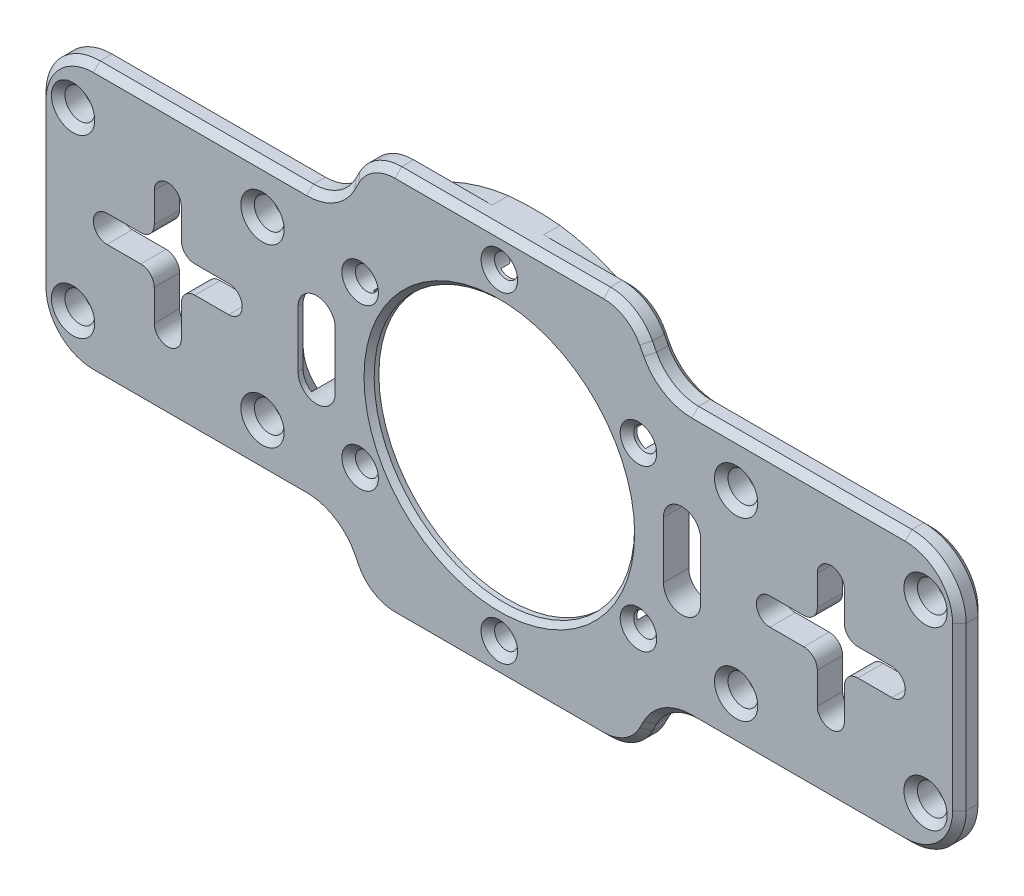
from build123d import *

# Parameters (mm, degrees)
SKETCH1_W           = 136
SKETCH1_H           = 57.5
SKETCH1_R           = 19.25
BOSS_EXTRUDE1_DEPTH = 3.75
SKETCH2_R           = 22.6
CUT_EXTRUDE1_DEPTH  = 2.3
SKETCH8_R           = 27
BOSS_EXTRUDE2_DEPTH = 2
SKETCH3_R           = 1.7
CUT_EXTRUDE2_DEPTH  = 75.051502348
CUT_EXTRUDE7_DEPTH  = 75.051502348
FILLET3_R           = 7
FILLET4_R           = 8
CHAMFER1_SIZE       = 1
SKETCH4_R           = 2.2
CUT_EXTRUDE3_DEPTH  = 75.051502348
CHAMFER2_SIZE       = 1
CHAMFER3_SIZE       = 1
CHAMFER4_SIZE       = 0.75
CUT_EXTRUDE4_DEPTH  = 75.051502348
FILLET1_R           = 2
FILLET2_R           = 2
SKETCH9_W           = 41
SKETCH9_H           = 37.4730356
CUT_EXTRUDE5_DEPTH  = 74.923101976
CUT_EXTRUDE6_DEPTH  = 75.051502395
CHAMFER6_SIZE       = 3
CHAMFER7_SIZE       = 1


with BuildPart() as part:
    # Sketch1 → Boss-Extrude1 (new body)
    with BuildSketch(Plane.XY):
        Rectangle(SKETCH1_W, SKETCH1_H)
        Circle(SKETCH1_R, mode=Mode.SUBTRACT)
    extrude(amount=BOSS_EXTRUDE1_DEPTH)

    # Sketch2 → Cut-Extrude1 (cut)
    with BuildSketch(Plane(origin=(0, 0, 0), x_dir=(-1, 0, 0), z_dir=(0, 0, -1))):
        Circle(SKETCH2_R)
    extrude(amount=-CUT_EXTRUDE1_DEPTH, mode=Mode.SUBTRACT)

    # Sketch8 → Boss-Extrude2 (add)
    with BuildSketch(Plane(origin=(0, 0, 0), x_dir=(-1, 0, 0), z_dir=(0, 0, -1))):
        with BuildLine():
            Line((3.799671038, 28.75), (-3.799671038, 28.75))
            ThreePointArc((-3.799671038, 28.75), (-29, 0), (-3.799671038, -28.75))
            Line((-3.799671038, -28.75), (3.799671038, -28.75))
            ThreePointArc((3.799671038, -28.75), (29, 0), (3.799671038, 28.75))
        make_face()
        Circle(SKETCH8_R, mode=Mode.SUBTRACT)
    extrude(amount=BOSS_EXTRUDE2_DEPTH)

    # Sketch3 → Cut-Extrude2 (cut, through all)
    with BuildSketch(Plane.XY.offset(3.75)):
        with Locations((0, 23.75)):
            Circle(SKETCH3_R)
        with Locations((20.56810334, 11.875)):
            Circle(SKETCH3_R)
        with Locations((20.56810334, -11.875)):
            Circle(SKETCH3_R)
        with Locations((0, -23.75)):
            Circle(SKETCH3_R)
        with Locations((-20.56810334, -11.875)):
            Circle(SKETCH3_R)
        with Locations((-20.56810334, 11.875)):
            Circle(SKETCH3_R)
    extrude(amount=-CUT_EXTRUDE2_DEPTH, mode=Mode.SUBTRACT)

    # Sketch11 → Cut-Extrude7 (cut, through all)
    with BuildSketch(Plane.XY.offset(3.75)):
        Polygon((-24.187984705, 20), (-68, 20), (-68, 28.75), (-19.687984705, 28.75), align=None)
        Polygon((68, 28.75), (19.687984705, 28.75), (24.187984705, 20), (68, 20), align=None)
        Polygon((19.687984705, -28.75), (24.187984705, -20), (68, -20), (68, -28.75), align=None)
        Polygon((-68, -28.75), (-19.687984705, -28.75), (-24.187984705, -20), (-68, -20), align=None)
    extrude(amount=-CUT_EXTRUDE7_DEPTH, mode=Mode.SUBTRACT)

    # Fillet3
    fillet3_edges = [part.edges().sort_by_distance(p)[0] for p in [
        (-19.687984705, -28.75, 1.875),
        (-24.187984705, -20, 1.875),
        (19.687984705, -28.75, 1.875),
        (24.187984705, -20, 1.875),
        (24.187984705, 20, 1.875),
        (-24.187984705, 20, 1.875),
        (-19.687984705, 28.75, 1.875),
        (19.687984705, 28.75, 1.875),
    ]]
    fillet(fillet3_edges, radius=FILLET3_R)

    # Fillet4
    fillet4_edges = [part.edges().sort_by_distance(p)[0] for p in [
        (-68, -20, 1.875),
        (68, 20, 1.875),
        (-68, 20, 1.875),
        (68, -20, 1.875),
    ]]
    fillet(fillet4_edges, radius=FILLET4_R)

    # Chamfer1
    chamfer1_edges = [part.edges().sort_by_distance(p)[0] for p in [
        (-1.7, 23.75, 3.75),
        (-22.26810334, 11.875, 3.75),
        (-22.26810334, -11.875, 3.75),
        (-1.7, -23.75, 3.75),
        (18.86810334, -11.875, 3.75),
        (18.86810334, 11.875, 3.75),
    ]]
    chamfer(chamfer1_edges, length=CHAMFER1_SIZE)

    # Sketch4 → Cut-Extrude3 (cut, through all)
    with BuildSketch(Plane.XY.offset(3.75)):
        with Locations((-63, 13)):
            Circle(SKETCH4_R)
        with Locations((-35, 13)):
            Circle(SKETCH4_R)
        with Locations((-35, -13)):
            Circle(SKETCH4_R)
        with Locations((-63, -13)):
            Circle(SKETCH4_R)
        with Locations((63, -13)):
            Circle(SKETCH4_R)
        with Locations((35, -13)):
            Circle(SKETCH4_R)
        with Locations((35, 13)):
            Circle(SKETCH4_R)
        with Locations((63, 13)):
            Circle(SKETCH4_R)
    extrude(amount=-CUT_EXTRUDE3_DEPTH, mode=Mode.SUBTRACT)

    # Chamfer2
    chamfer2_edges = [part.edges().sort_by_distance(p)[0] for p in [
        (0, 28.75, 3.75),
        (9.608094141, 28.75, 0),
        (-44.229726083, -20, 3.75),
        (-21.937984705, -24.375, 3.75),
        (0, -28.75, 3.75),
        (21.937984705, -24.375, 3.75),
        (44.229726083, 20, 3.75),
        (21.937984705, 24.375, 3.75),
        (-21.937984705, 24.375, 3.75),
        (19.062744566, 27.725368299, 3.75),
        (-19.062744566, -27.725368299, 3.75),
        (19.062744566, -27.725368299, 3.75),
        (-19.062744566, 27.725368299, 3.75),
        (-21.937984705, 24.375, 0),
        (-21.937984705, -24.375, 0),
        (-44.229726083, -20, 0),
        (-9.608094141, -28.75, 0),
        (-19.062744566, -27.725368299, 0),
        (-19.062744566, 27.725368299, 0),
        (21.937984705, -24.375, 0),
        (21.937984705, 24.375, 0),
        (44.229726083, 20, 0),
        (19.062744566, 27.725368299, 0),
        (19.062744566, -27.725368299, 0),
        (-24.813224844, 21.024631701, 3.75),
        (-24.813224844, 21.024631701, 0),
        (24.813224844, -21.024631701, 3.75),
        (24.813224844, -21.024631701, 0),
        (-24.813224844, -21.024631701, 3.75),
        (-24.813224844, -21.024631701, 0),
        (24.813224844, 21.024631701, 3.75),
        (24.813224844, 21.024631701, 0),
        (68, 0, 3.75),
        (68, 0, 0),
        (44.229726083, -20, 0),
        (65.656854249, 17.656854249, 0),
        (65.656854249, -17.656854249, 0),
        (44.229726083, -20, 3.75),
        (-44.229726083, 20, 3.75),
        (-68, 0, 3.75),
        (-65.656854249, -17.656854249, 3.75),
        (-65.656854249, 17.656854249, 3.75),
        (65.656854249, 17.656854249, 3.75),
        (65.656854249, -17.656854249, 3.75),
        (-44.229726083, 20, 0),
        (-68, 0, 0),
        (-65.656854249, -17.656854249, 0),
        (-65.656854249, 17.656854249, 0),
        (-9.608094141, 28.75, 0),
        (9.608094141, -28.75, 0),
    ]]
    chamfer(chamfer2_edges, length=CHAMFER2_SIZE)

    # Chamfer3
    chamfer3_edges = [part.edges().sort_by_distance(p)[0] for p in [
        (60.8, -13, 3.75),
        (-65.2, -13, 3.75),
        (-37.2, -13, 3.75),
        (-37.2, 13, 3.75),
        (32.8, -13, 3.75),
        (32.8, 13, 3.75),
        (60.8, 13, 3.75),
        (-65.2, 13, 3.75),
    ]]
    chamfer(chamfer3_edges, length=CHAMFER3_SIZE)

    # Chamfer4
    chamfer4_edges = [part.edges().sort_by_distance(p)[0] for p in [
        (-19.25, 0, 3.75),
    ]]
    chamfer(chamfer4_edges, length=CHAMFER4_SIZE)

    # Sketch5 → Cut-Extrude4 (cut, through all)
    with BuildSketch(Plane.XY.offset(3.75)):
        with BuildLine():
            Line((-47, 8.400054732), (-47, 2))
            Line((-47, 2), (-40, 2))
            ThreePointArc((-40, 2), (-38, 0), (-40, -2))
            Line((-40, -2), (-47, -2))
            Line((-47, -2), (-47, -8.599945268))
            ThreePointArc((-47, -8.599945268), (-49, -10.599945268), (-51, -8.599945268))
            Line((-51, -8.599945268), (-51, -2))
            Line((-51, -2), (-58, -2))
            ThreePointArc((-58, -2), (-60, 0), (-58, 2))
            Line((-58, 2), (-51, 2))
            Line((-51, 2), (-51, 8.400054732))
            ThreePointArc((-51, 8.400054732), (-49, 10.400054732), (-47, 8.400054732))
        make_face()
        with BuildLine():
            Line((47, -2), (40, -2))
            ThreePointArc((40, -2), (38, 0), (40, 2))
            Line((40, 2), (47, 2))
            Line((47, 2), (47, 8.400054732))
            ThreePointArc((47, 8.400054732), (49, 10.400054732), (51, 8.400054732))
            Line((51, 8.400054732), (51, 2))
            Line((51, 2), (58, 2))
            ThreePointArc((58, 2), (60, 0), (58, -2))
            Line((58, -2), (51, -2))
            Line((51, -2), (51, -8.599945268))
            ThreePointArc((51, -8.599945268), (49, -10.599945268), (47, -8.599945268))
            Line((47, -8.599945268), (47, -2))
        make_face()
    extrude(amount=-CUT_EXTRUDE4_DEPTH, mode=Mode.SUBTRACT)

    # Fillet1
    fillet1_edges = [part.edges().sort_by_distance(p)[0] for p in [
        (-47, 2, 1.875),
        (-47, -2, 1.875),
        (-51, -2, 1.875),
        (-51, 2, 1.875),
        (47, 2, 1.875),
        (51, 2, 1.875),
        (51, -2, 1.875),
        (47, -2, 1.875),
    ]]
    fillet(fillet1_edges, radius=FILLET1_R)

    # Fillet2
    fillet2_edges = [part.edges().sort_by_distance(p)[0] for p in [
        (-29, 0, 0),
        (29, 0, 0),
    ]]
    fillet(fillet2_edges, radius=FILLET2_R - 0.0001)  # a hair under: the kernel refuses the full size

    # Sketch9 → Cut-Extrude5 (cut, through all)
    with BuildSketch(Plane(origin=(0, 0, 0), x_dir=(-1, 0, 0), z_dir=(0, 0, -1))):
        with Locations((-49, 0)):
            Rectangle(SKETCH9_W, SKETCH9_H)
        with Locations((49, 0)):
            Rectangle(SKETCH9_W, SKETCH9_H)
    extrude(amount=CUT_EXTRUDE5_DEPTH, mode=Mode.SUBTRACT)

    # Sketch10 → Cut-Extrude6 (cut, through all)
    with BuildSketch(Plane.XY.offset(3.75)):
        with BuildLine():
            Line((-24.25, 4.184542955), (-24.25, -4.184542955))
            ThreePointArc((-24.25, -4.184542955), (-27, -6.934542955), (-29.75, -4.184542955))
            Line((-29.75, -4.184542955), (-29.75, 4.184542955))
            ThreePointArc((-29.75, 4.184542955), (-27, 6.934542955), (-24.25, 4.184542955))
        make_face()
        with BuildLine():
            Line((24.25, 4.184542955), (24.25, -4.184542955))
            ThreePointArc((24.25, -4.184542955), (27, -6.934542955), (29.75, -4.184542955))
            Line((29.75, -4.184542955), (29.75, 4.184542955))
            ThreePointArc((29.75, 4.184542955), (27, 6.934542955), (24.25, 4.184542955))
        make_face()
    extrude(amount=-CUT_EXTRUDE6_DEPTH, mode=Mode.SUBTRACT)

    # Chamfer6
    chamfer6_edges = [part.edges().sort_by_distance(p)[0] for p in [
        (29.75, 0, 0),
        (-29.75, 0, 0),
        (-29.417384951, 5.495554016, 0),
        (-29.417384951, -5.495554016, 0),
        (29.417384951, 5.495554016, 0),
        (29.417384951, -5.495554016, 0),
    ]]
    chamfer(chamfer6_edges, length=CHAMFER6_SIZE)

    # Chamfer7
    chamfer7_edges = [part.edges().sort_by_distance(p)[0] for p in [
        (-11.3, 19.572174126, 0),
        (11.3, 19.572174126, 0),
        (22.6, 0, 0),
        (11.3, -19.572174126, 0),
        (-11.3, -19.572174126, 0),
        (-22.6, 0, 0),
    ]]
    chamfer(chamfer7_edges, length=CHAMFER7_SIZE)

    # Chamfer8: read off the stored shape, not the designer's step
    # Chamfer8 outline → Chamfer8 (revolve, cut)
    with BuildSketch(Plane.XZ):
        Polygon((29.114381917, -1.333333333), (28.171572875, -2), (29.114381917, -2), align=None)
    revolve(axis=Axis((0, 0, 0), (0, 0, 1)), mode=Mode.SUBTRACT)


solid = part.part
